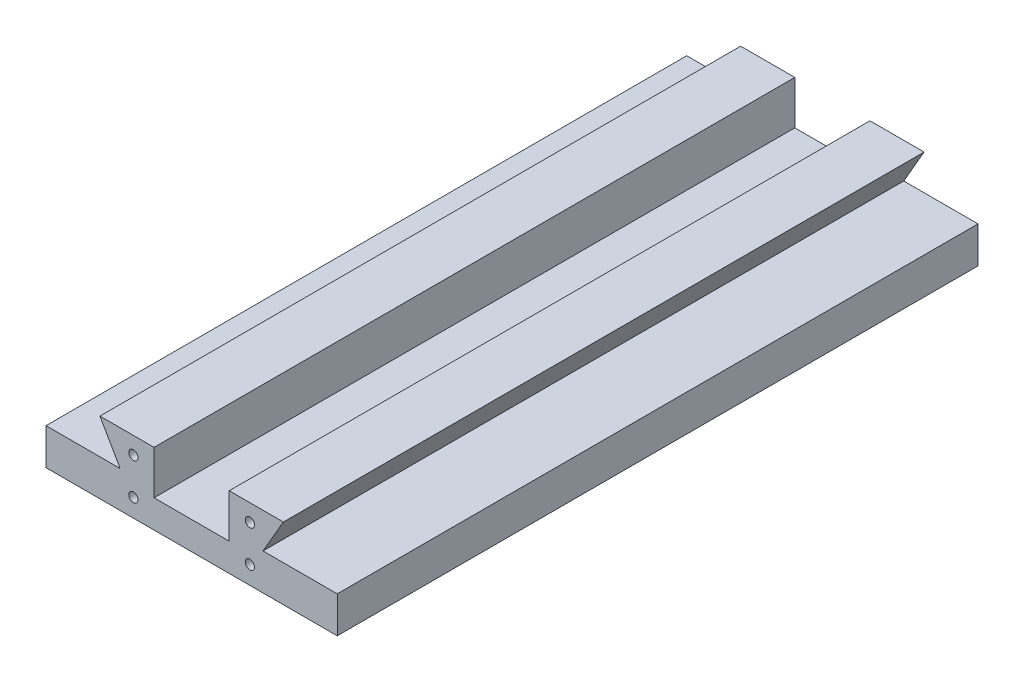
from build123d import *

# Parameters (mm, degrees)
X_GUIDE_EXTRUDE_DEPTH   = 279.4
END_PLATE_HOLES_D       = 4.0386
END_PLATE_HOLES_DEPTH   = 11.938
END_PLATE_HOLES_TIP     = 1.213317848
END_PLATE_HOLES_2_D     = 4.0386
END_PLATE_HOLES_2_DEPTH = 11.938
END_PLATE_HOLES_2_TIP   = 1.213317848


with BuildPart() as part:
    # dovetail-male-profile → x-guide-extrude (new body)
    with BuildSketch(Plane.XY):
        Polygon((31.127216058, 15.875), (39.999357645, 31.242), (16.383, 31.242), (16.383, 12.192), (-16.383, 12.192), (-16.383, 31.242), (-39.999357645, 31.242), (-31.127216058, 15.875), (-63.5, 15.875), (-63.5, 0), (63.5, 0), (63.5, 15.875), (38.459564477, 15.875), align=None)
    extrude(amount=X_GUIDE_EXTRUDE_DEPTH)

    # end plate holes
    with Locations(Plane(origin=(0, 0, 0), x_dir=(-1, 0, 0), z_dir=(0, 0, -1))):
        with Locations((-25.4, 23.8125), (25.4, 23.8125), (25.4, 7.874), (-25.4, 7.874)):
            Hole(END_PLATE_HOLES_D / 2, depth=END_PLATE_HOLES_DEPTH)
            with Locations((0, 0, -(END_PLATE_HOLES_DEPTH + END_PLATE_HOLES_TIP / 2))):  # 118° drill point
                Cone(0, END_PLATE_HOLES_D / 2, END_PLATE_HOLES_TIP, mode=Mode.SUBTRACT)

    # end plate holes 2
    with Locations(Plane.XY.offset(279.4)):
        with Locations((25.4, 23.8125), (25.4, 7.874), (-25.4, 7.874), (-25.4, 23.8125)):
            Hole(END_PLATE_HOLES_2_D / 2, depth=END_PLATE_HOLES_2_DEPTH)
            with Locations((0, 0, -(END_PLATE_HOLES_2_DEPTH + END_PLATE_HOLES_2_TIP / 2))):  # 118° drill point
                Cone(0, END_PLATE_HOLES_2_D / 2, END_PLATE_HOLES_2_TIP, mode=Mode.SUBTRACT)


solid = part.part
